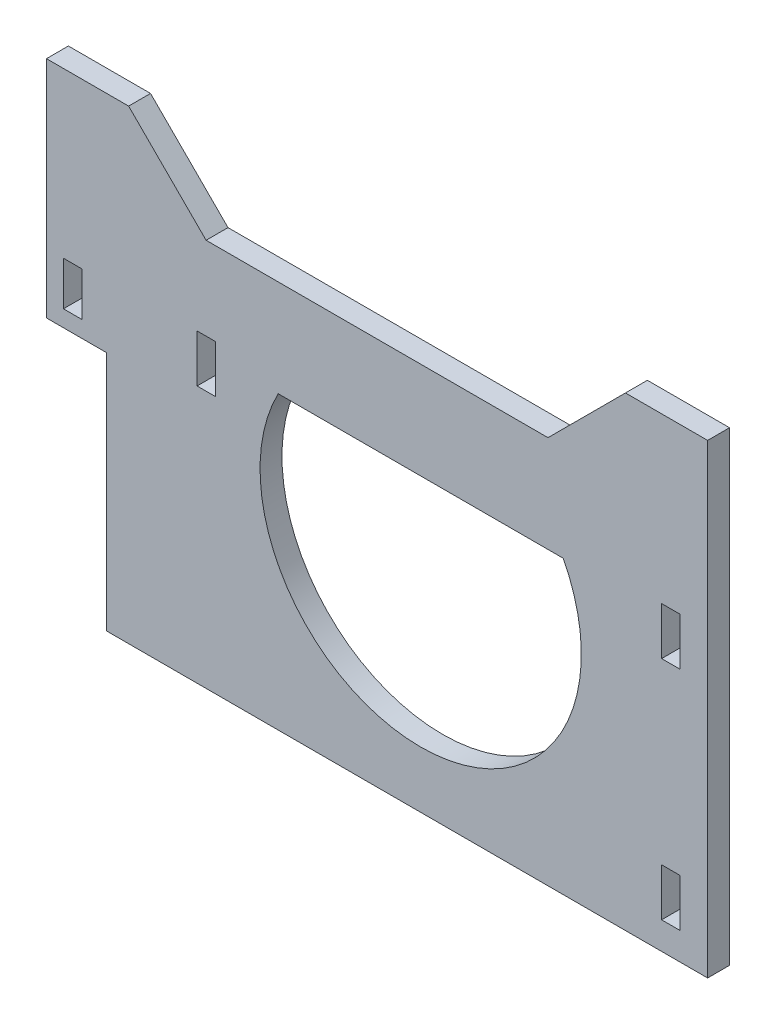
from build123d import *

# Parameters (mm, degrees)
SKETCH1_W           = 3.4
SKETCH1_H           = 8.7
SKETCH1_H_2         = 8
BOSS_EXTRUDE1_DEPTH = 4
BOSS_EXTRUDE2_DEPTH = 4


with BuildPart() as part:
    # Sketch1 → Boss-Extrude1 (new body)
    with BuildSketch(Plane.XY):
        Polygon((52.5, 30), (52.5, -30), (-57.2, -30), (-57.2, 14), (-68.2, 14), (-68.2, 30), align=None)
        with BuildLine():
            Line((-25.900000003, 23.179137901), (26.135555553, 23.179137901))
            ThreePointArc((26.135555553, 23.179137901), (0.117777775, -19.676914391), (-25.900000003, 23.179137901))
        make_face(mode=Mode.SUBTRACT)
        with Locations((-39, 21.35)):
            Rectangle(SKETCH1_W, SKETCH1_H, mode=Mode.SUBTRACT)
        with Locations((45.8, 20.65)):
            Rectangle(SKETCH1_W, SKETCH1_H, mode=Mode.SUBTRACT)
        with Locations((45.8, -20.65)):
            Rectangle(SKETCH1_W, SKETCH1_H, mode=Mode.SUBTRACT)
        with Locations((-63.4, 21)):
            Rectangle(SKETCH1_W, SKETCH1_H_2, mode=Mode.SUBTRACT)
    extrude(amount=BOSS_EXTRUDE1_DEPTH)

    # Sketch2 → Boss-Extrude2 (add)
    with BuildSketch(Plane.XY):
        Polygon((-68.2, 30), (52.5, 30), (52.5, 55), (37.5, 55), (23.357864376, 40.857864376), (-39.057864376, 40.857864376), (-53.2, 55), (-68.2, 55), align=None)
    extrude(amount=BOSS_EXTRUDE2_DEPTH)


solid = part.part
